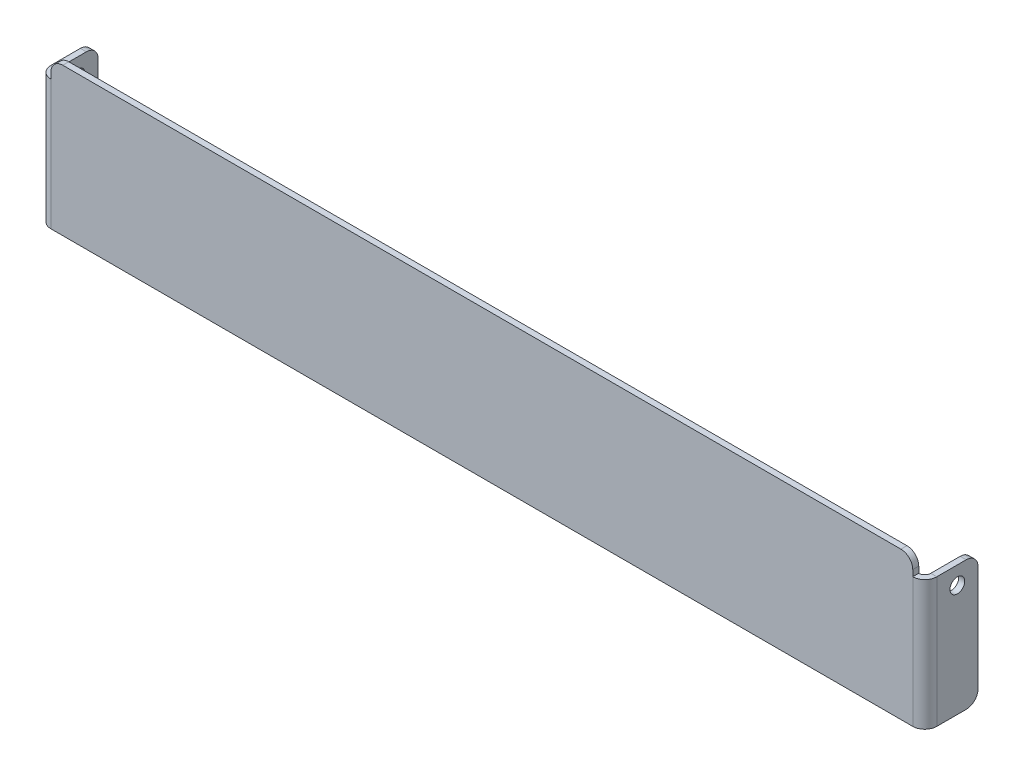
from build123d import *

# Parameters (mm, degrees)
SKETCH2_W                   = 72.968
SKETCH2_H                   = 24.996
BASE_FLANGE1_DEPTH          = 1.016
EDGE_FLANGE1_DEPTH          = 21.948
FILLET1_R                   = 2
TAP_DRILL_FOR_M3X0_5_TAP1_D = 2.5


# Sheet-metal steps are written as plain solids
with BuildPart() as part:
    # Sketch2 → Base-Flange1 (new body)
    with BuildSketch(Plane.XY):
        with Locations((-36.484, -12.498)):
            Rectangle(SKETCH2_W, SKETCH2_H)
    extrude(amount=-BASE_FLANGE1_DEPTH)

    # Edge-Flange1 section (across the edge) → Edge-Flange1 (add)
    with BuildSketch(Plane(origin=(-73.984, -24.996, -1.016), x_dir=(1, 0, 0), z_dir=(0, 1, 0))):
        with BuildLine():
            Line((-1.016, 1.016), (-1.016, 8))
            Line((-1.016, 8), (0, 8))
            Line((0, 8), (0, 1.016))
            ThreePointArc((0, 1.016), (0.29757951, 0.29757951), (1.016, 0))
            Line((1.016, 0), (1.016, -1.016))
            ThreePointArc((1.016, -1.016), (-0.420840979, -0.420840979), (-1.016, 1.016))
        make_face()
    extrude(amount=EDGE_FLANGE1_DEPTH)

    # Fillet1
    fillet1_edges = [part.edges().sort_by_distance(p)[0] for p in [
        (-74.492, -24.996, -9.016),
        (-74.492, -3.048, -9.016),
        (-72.968, 0, -0.508),
    ]]
    fillet(fillet1_edges, radius=FILLET1_R)

    # Tap Drill for M3x0.5 Tap1 (through all)
    with Locations(Plane.ZY.offset(75)):
        with Locations((-5.524, -6.048)):
            Hole(TAP_DRILL_FOR_M3X0_5_TAP1_D / 2)

    # Mirror1: part across plane


with BuildPart() as part_1:
    add(part.part)
    add(part.part.mirror(Plane(origin=(0, -24.996, -1.016), x_dir=(0, 0, 1), z_dir=(1, 0, 0))))


solid = part_1.part
